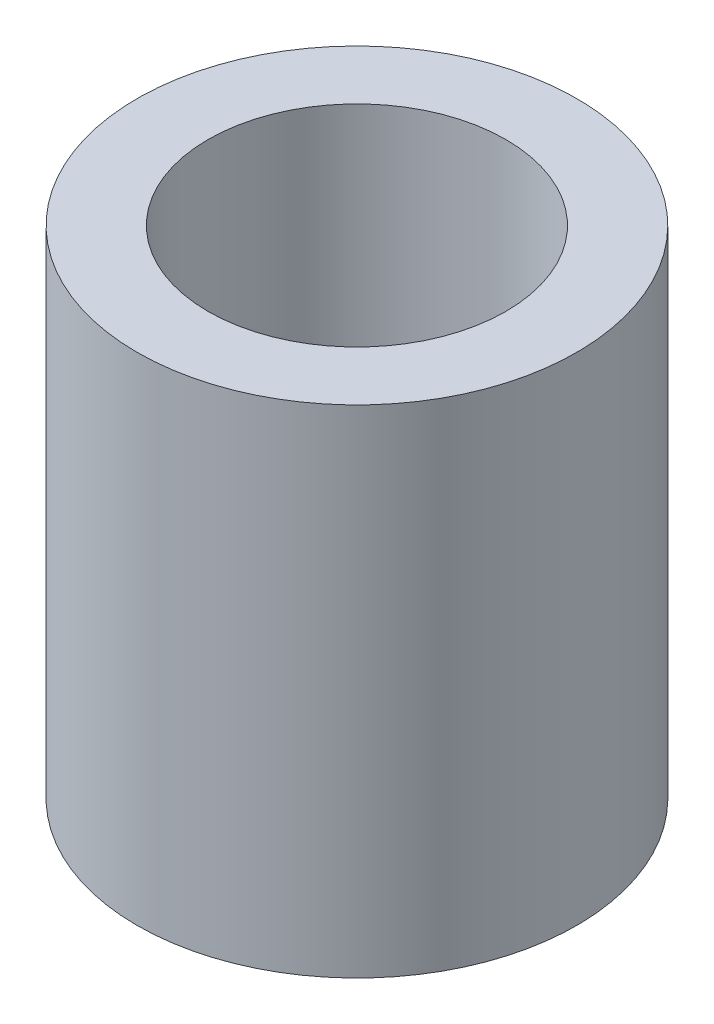
from build123d import *

# Parameters (mm, degrees)
SKETCH1_R           = 3.1
BOSS_EXTRUDE1_DEPTH = 7
SKETCH2_R           = 2.1
CUT_EXTRUDE1_DEPTH  = 7


with BuildPart() as part:
    # Sketch1 → Boss-Extrude1 (new body)
    with BuildSketch(Plane(origin=(0, 0, 0), x_dir=(1, 0, 0), z_dir=(0, 1, 0))):
        Circle(SKETCH1_R)
    extrude(amount=BOSS_EXTRUDE1_DEPTH)

    # Sketch2 → Cut-Extrude1 (cut)
    with BuildSketch(Plane(origin=(0, 7, 0), x_dir=(1, 0, 0), z_dir=(0, 1, 0))):
        Circle(SKETCH2_R)
    extrude(amount=-CUT_EXTRUDE1_DEPTH, mode=Mode.SUBTRACT)


solid = part.part
